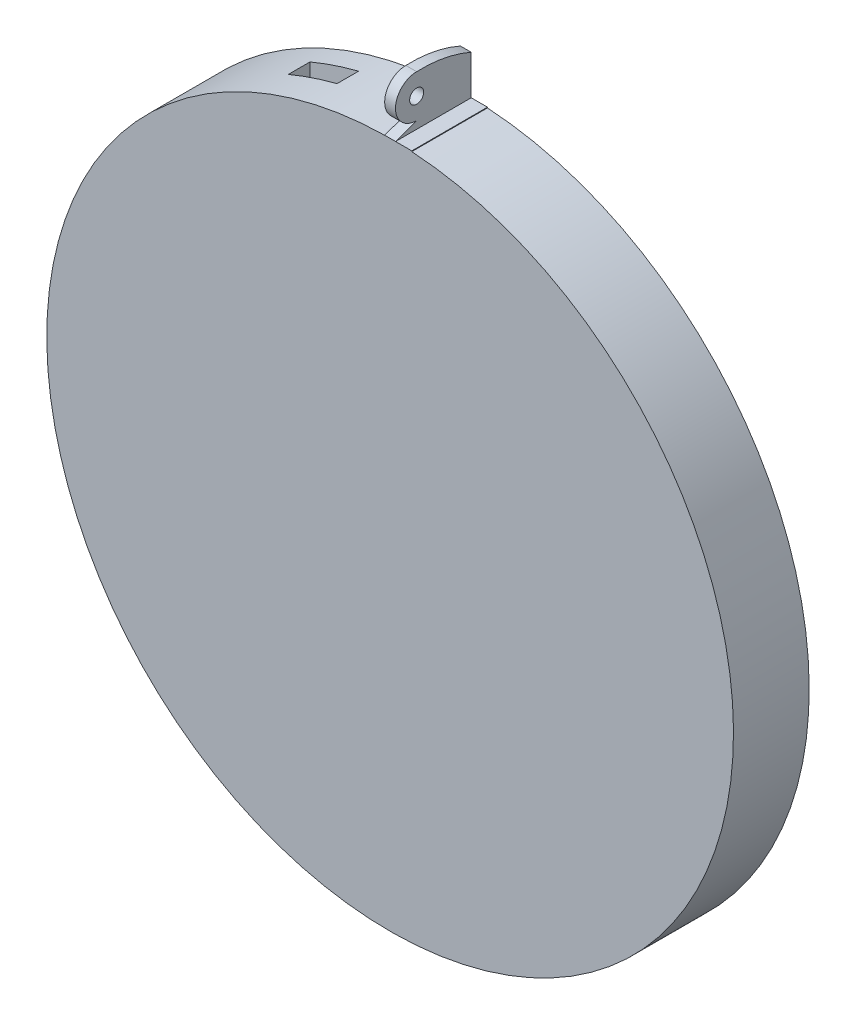
from build123d import *

# Parameters (mm, degrees)
SKETCH1_R                = 63.5
BOSS_EXTRUDE2_DEPTH      = 23
SHELL4_T                 = -3
SKETCH4_R                = 56.09702957
CUT_EXTRUDE1_DEPTH       = 22
BOSS_EXTRUDE6_DEPTH      = 1
BOSS_EXTRUDE6_DEPTH_BACK = 1
SKETCH8_R                = 1.3
BOSS_EXTRUDE7_REACH      = 145.843
BOSS_EXTRUDE7_END_RADIUS = 63.5
SKETCH9_W                = 5
SKETCH9_H                = 23
SKETCH11_R               = 63.5
CUT_EXTRUDE2_DEPTH       = 9
SKETCH12_W               = 19.480164653
SKETCH12_H               = 12.222333769
CUT_EXTRUDE3_DEPTH       = 13
BOSS_EXTRUDE8_START      = -2
SKETCH13_R               = 63.5
BOSS_EXTRUDE8_DEPTH      = 2
SKETCH15_W               = 9
SKETCH15_H               = 4
CUT_EXTRUDE4_DEPTH       = 89
SKETCH16_R               = 1.5
BOSS_EXTRUDE9_DEPTH      = 10


with BuildPart() as part:
    # Sketch1 → Boss-Extrude2 (new body)
    with BuildSketch(Plane.XY):
        Circle(SKETCH1_R)
    extrude(amount=BOSS_EXTRUDE2_DEPTH)

    # Shell4
    shell4_openings = [part.faces().sort_by_distance(p)[0] for p in [
        (0, 0, 0),
    ]]
    offset(amount=SHELL4_T, openings=shell4_openings, kind=Kind.INTERSECTION)

    # Sketch4 → Cut-Extrude1 (cut)
    with BuildSketch(Plane(origin=(0, 0, 20), x_dir=(-1, 0, 0), z_dir=(0, 0, -1))):
        Circle(SKETCH4_R)
    extrude(amount=-CUT_EXTRUDE1_DEPTH, mode=Mode.SUBTRACT)



with BuildPart() as body_2:
    # Sketch8 → Boss-Extrude6 (new, two sides: drawn at the far end of the back side and taken through both)
    with BuildSketch(Plane(origin=(0, 0, 0), x_dir=(0, 0, -1), z_dir=(1, 0, 0)).offset(-BOSS_EXTRUDE6_DEPTH_BACK)):
        with BuildLine():
            Line((-23, 63.5), (0, 63.5))
            ThreePointArc((0, 63.5), (-8.388517362, 70.509736152), (-19.092759253, 72.728481295))
            ThreePointArc((-19.092759253, 72.728481295), (-23.009560108, 68.811680441), (-19.092759253, 64.894879586))
            ThreePointArc((-19.092759253, 64.894879586), (-21.050529465, 64.209064035), (-23, 63.5))
        make_face()
        with Locations((-19.092759253, 68.811680441)):
            Circle(SKETCH8_R, mode=Mode.SUBTRACT)
    extrude(amount=BOSS_EXTRUDE6_DEPTH + BOSS_EXTRUDE6_DEPTH_BACK)


with BuildPart() as part_1:
    add(part.part)

    add(body_2.part)  # Boss-Extrude7 merges body 2
    # Boss-Extrude7: up to this cylinder (the profile starts outside it)
    boss_extrude7_end = Plane(origin=(0, 0, 11.5), z_dir=(0, 0, -1)) * Cylinder(BOSS_EXTRUDE7_END_RADIUS, 419.686, mode=Mode.PRIVATE)
    # Sketch9 → Boss-Extrude7 (add, up to the surface)
    with BuildSketch(Plane.XZ.offset(-63.5), mode=Mode.PRIVATE) as boss_extrude7_sk1:
        with Locations((1.5, 11.5)):
            Rectangle(SKETCH9_W, SKETCH9_H)
    boss_extrude7_tool1 = extrude(boss_extrude7_sk1.sketch, amount=BOSS_EXTRUDE7_REACH, mode=Mode.PRIVATE) - boss_extrude7_end
    add(boss_extrude7_tool1.solids().sort_by_distance((1.5, 63.5, 11.5))[0])
    add(boss_extrude7_tool1.solids().sort_by_distance((1.5, 63.5, 11.5))[1])

    # Sketch11 → Cut-Extrude2 (cut)
    with BuildSketch(Plane(origin=(0, 0, 0), x_dir=(-1, 0, 0), z_dir=(0, 0, -1))):
        Circle(SKETCH11_R)
    extrude(amount=-CUT_EXTRUDE2_DEPTH, mode=Mode.SUBTRACT)

    # Sketch12 → Cut-Extrude3 (cut)
    with BuildSketch(Plane(origin=(0, 0, 9), x_dir=(-1, 0, 0), z_dir=(0, 0, -1))):
        with Locations((1.337314283, 69.052754799)):
            Rectangle(SKETCH12_W, SKETCH12_H)
    extrude(amount=CUT_EXTRUDE3_DEPTH, mode=Mode.SUBTRACT)

    # Sketch13 → Boss-Extrude8 (add)
    with BuildSketch(Plane.XY.offset(23).offset(BOSS_EXTRUDE8_START)):
        Circle(SKETCH13_R)
    extrude(amount=BOSS_EXTRUDE8_DEPTH)

    # Sketch15 → Cut-Extrude4 (cut)
    with BuildSketch(Plane(origin=(0, 0, 0), x_dir=(1, 0, 0), z_dir=(0, 1, 0))):
        with Locations((-20.134408765, -15.199194611)):
            Rectangle(SKETCH15_W, SKETCH15_H)
    extrude(amount=CUT_EXTRUDE4_DEPTH, mode=Mode.SUBTRACT)

    # Sketch16 → Boss-Extrude9 (add)
    with BuildSketch(Plane(origin=(0, 0, 21), x_dir=(-1, 0, 0), z_dir=(0, 0, -1))):
        with Locations((10, -17.5)):
            Circle(SKETCH16_R)
        with Locations((10, 17.5)):
            Circle(SKETCH16_R)
    extrude(amount=BOSS_EXTRUDE9_DEPTH)


solid = part_1.part
